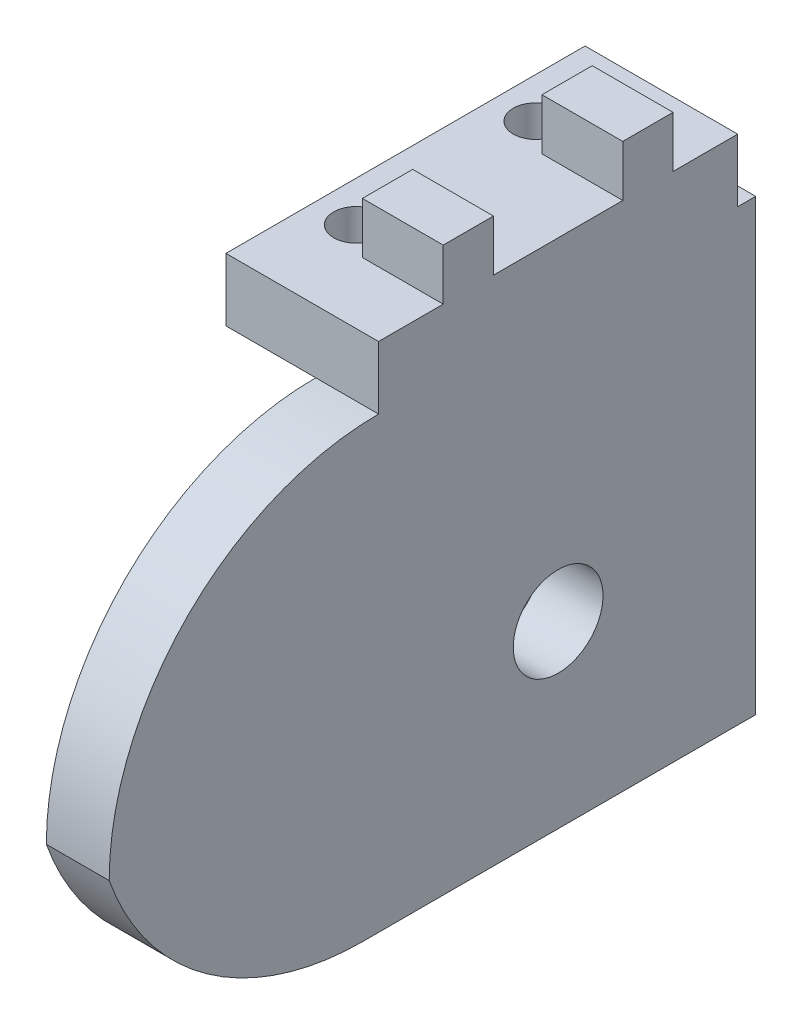
from build123d import *

# Parameters (mm, degrees)
CROQUIS1_W              = 40
CROQUIS1_H              = 40
SALIENTE_EXTRUIR1_DEPTH = 7
CROQUIS3_W              = 5.6
CROQUIS3_H              = 5.7
SALIENTE_EXTRUIR3_DEPTH = 40
CROQUIS19_W             = 8
CROQUIS19_H             = 40
CORTAR_EXTRUIR5_DEPTH   = 5.7
CROQUIS20_R             = 2.5
CORTAR_EXTRUIR6_DEPTH   = 7
CROQUIS21_W             = 7
CROQUIS21_H             = 72
SALIENTE_EXTRUIR4_DEPTH = 50
CROQUIS22_R             = 5
CORTAR_EXTRUIR7_DEPTH   = 7
REDONDEO1_R             = 30
REDONDEO2_R             = 30
CROQUIS28_R             = 4.25
CORTAR_EXTRUIR11_DEPTH  = 3
CROQUIS29_W             = 113.908789422
CROQUIS29_H             = 183.564538758
CORTAR_EXTRUIR12_DEPTH  = 23


# Some blends are built 0.0001 mm under size
with BuildPart() as part:
    # Croquis1 → Saliente-Extruir1 (new body)
    with BuildSketch(Plane(origin=(0, 0, 0), x_dir=(1, 0, 0), z_dir=(0, 1, 0))):
        Rectangle(CROQUIS1_W, CROQUIS1_H)
    extrude(amount=SALIENTE_EXTRUIR1_DEPTH)

    # Croquis3 → Saliente-Extruir3 (add)
    with BuildSketch(Plane.ZY.offset(20)):
        with Locations((10, 9.85)):
            Rectangle(CROQUIS3_W, CROQUIS3_H)
        with Locations((-10, 9.85)):
            Rectangle(CROQUIS3_W, CROQUIS3_H)
    extrude(amount=-SALIENTE_EXTRUIR3_DEPTH)

    # Croquis19 → Cortar-Extruir5 (cut)
    with BuildSketch(Plane(origin=(0, 12.7, 0), x_dir=(1, 0, 0), z_dir=(0, 1, 0))):
        with Locations((-16, 0)):
            Rectangle(CROQUIS19_W, CROQUIS19_H)
        with Locations((16, 0)):
            Rectangle(CROQUIS19_W, CROQUIS19_H)
    extrude(amount=-CORTAR_EXTRUIR5_DEPTH, mode=Mode.SUBTRACT)

    # Croquis20 → Cortar-Extruir6 (cut)
    with BuildSketch(Plane(origin=(0, 7, 0), x_dir=(1, 0, 0), z_dir=(0, 1, 0))):
        with Locations(Location((-15.5, 10, 0), (0, 0, 270))):
            Circle(CROQUIS20_R)
        with Locations(Location((15.5, 10, 0), (0, 0, 270))):
            Circle(CROQUIS20_R)
        with Locations(Location((15.5, -10, 0), (0, 0, 270))):
            Circle(CROQUIS20_R)
        with Locations(Location((-15.5, -10, 0), (0, 0, 270))):
            Circle(CROQUIS20_R)
    extrude(amount=-CORTAR_EXTRUIR6_DEPTH, mode=Mode.SUBTRACT)

    # Croquis21 → Saliente-Extruir4 (add)
    with BuildSketch(Plane.XZ):
        with Locations((-6.5, 14)):
            Rectangle(CROQUIS21_W, CROQUIS21_H)
    extrude(amount=SALIENTE_EXTRUIR4_DEPTH)

    # Croquis22 → Cortar-Extruir7 (cut)
    with BuildSketch(Plane(origin=(-3, 0, 0), x_dir=(0, 0, -1), z_dir=(1, 0, 0))):
        with Locations((0, -30)):
            Circle(CROQUIS22_R)
    extrude(amount=-CORTAR_EXTRUIR7_DEPTH, mode=Mode.SUBTRACT)

    # Redondeo1
    redondeo1_edges = [part.edges().sort_by_distance(p)[0] for p in [
        (-6.5, 0, 50),
    ]]
    fillet(redondeo1_edges, radius=REDONDEO1_R - 0.0001)  # a hair under: the kernel refuses the full size

    # Redondeo2
    # the kernel refuses this fillet: 30 mm, written as the material it takes off along each edge
    with BuildSketch(Plane(origin=(67.710766507, -50, 50), x_dir=(0, 1, 0), z_dir=(-1, 0, 0))) as redondeo2_piece_1:
        with BuildLine():
            CenterArc((30, 28.284306603), REDONDEO2_R, 180, 70.528981937)
            Line((0, 28.284306603), (-0.6, 28.284306603))
            Line((-0.6, 28.284306603), (-0.6, 0))
            Line((-0.6, 0), (0, -0.6))
            ThreePointArc((0, -0.6), (10.00005, -0.6), (19.800102, -0.565686132))
            Line((19.800102, -0.565686132), (20.0001, 0))
        make_face()
    extrude(amount=148.421533013, mode=Mode.SUBTRACT)

    # Croquis28 → Cortar-Extruir11 (cut)
    with BuildSketch(Plane.ZY.offset(10)):
        with Locations((30, -30)):
            Circle(CROQUIS28_R)
    extrude(amount=-CORTAR_EXTRUIR11_DEPTH, mode=Mode.SUBTRACT)

    # Croquis29 → Cortar-Extruir12 (cut)
    with BuildSketch(Plane(origin=(20, 0, 0), x_dir=(0, 0, -1), z_dir=(1, 0, 0))):
        with Locations((0, 4.197692072)):
            Rectangle(CROQUIS29_W, CROQUIS29_H)
    extrude(amount=-CORTAR_EXTRUIR12_DEPTH, mode=Mode.SUBTRACT)


solid = part.part
